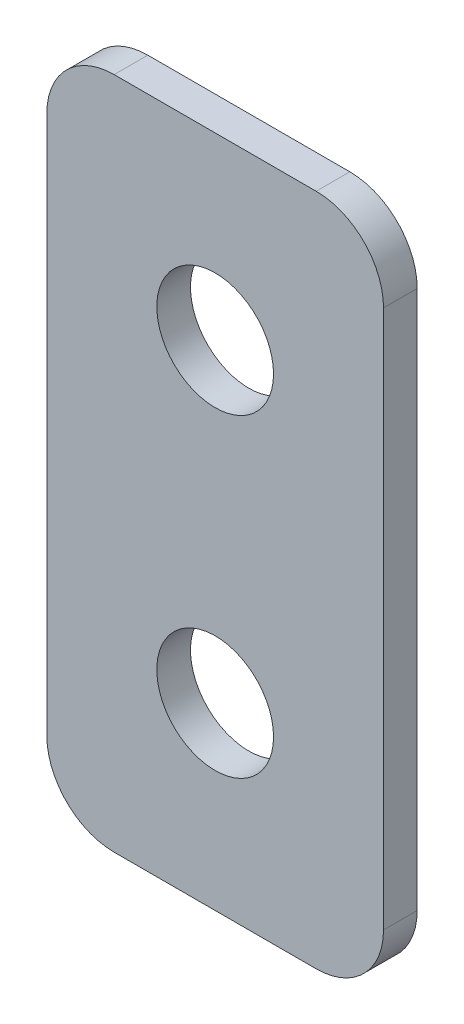
from build123d import *

# Parameters (mm, degrees)
CONVERT_SOLID1_START     = -1.5
CONVERT_SOLID1_OUTLINE_R = 2.6
CONVERT_SOLID1_DEPTH     = 1.5


# Read off the part's stored shape, not the designer's step: Convert-Solid1
with BuildPart() as part:
    # Convert-Solid1 outline → Convert-Solid1 (new body)
    with BuildSketch(Plane.XY.offset(CONVERT_SOLID1_START)):
        with BuildLine():
            Line((15, 3), (15, 27))
            ThreePointArc((15, 27), (14.121320344, 29.121320344), (12, 30))
            Line((12, 30), (3, 30))
            ThreePointArc((3, 30), (0.878679656, 29.121320344), (0, 27))
            Line((0, 27), (0, 3))
            ThreePointArc((0, 3), (0.878679656, 0.878679656), (3, 0))
            Line((3, 0), (12, 0))
            ThreePointArc((12, 0), (14.121320344, 0.878679656), (15, 3))
        make_face()
        with Locations((7.5, 8)):
            Circle(CONVERT_SOLID1_OUTLINE_R, mode=Mode.SUBTRACT)
        with Locations((7.5, 22)):
            Circle(CONVERT_SOLID1_OUTLINE_R, mode=Mode.SUBTRACT)
    extrude(amount=CONVERT_SOLID1_DEPTH)


solid = part.part
